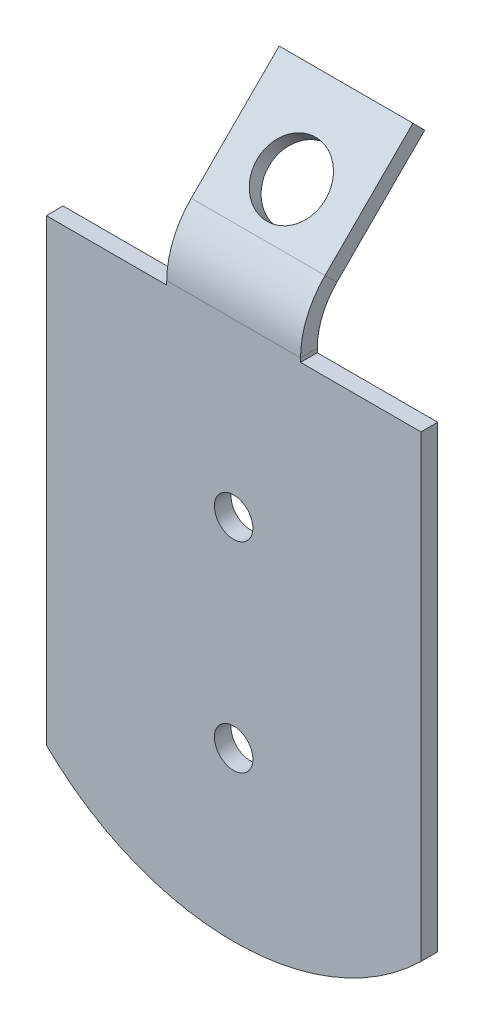
from build123d import *

# Parameters (mm, degrees)
BOSS_EXTRUDE1_DEPTH         = 1.5875
F_6_CLEARANCE_HOLE2_D       = 3.6576
F_6_CLEARANCE_HOLE2_DEPTH   = 38.354
F_6_CLEARANCE_HOLE2_TIP     = 1.0988539
SKETCHED_START              = -6.35
SKETCHED_BEND10_DEPTH       = 12.7
SKETCHED_BEND10_2_DEPTH     = 12.7
CUT_EXTRUDE1_DEPTH          = 45.703347893
F_1_4_CLEARANCE_HOLE1_D     = 6.5278
F_1_4_CLEARANCE_HOLE1_DEPTH = 38.354
F_1_4_CLEARANCE_HOLE1_TIP   = 1.961148974


# Read off the part's stored shape, not the designer's step: Sketched Bend10
with BuildPart() as part:
    # Sketch1 → Boss-Extrude1 (new body)
    with BuildSketch(Plane.XY):
        Polygon((-17.78, -25.4), (17.78, -25.4), (17.78, 25.4), (6.35, 25.4), (6.35, 43.18), (-6.35, 43.18), (-6.35, 25.4), (-17.78, 25.4), align=None)
    extrude(amount=BOSS_EXTRUDE1_DEPTH)

    # #6 Clearance Hole2
    with Locations(Plane(origin=(0, 0, 0), x_dir=(-1, 0, 0), z_dir=(0, 0, -1))):
        with Locations((0, 9.5), (0, -9.5)):
            Hole(F_6_CLEARANCE_HOLE2_D / 2, depth=F_6_CLEARANCE_HOLE2_DEPTH)
            with Locations((0, 0, -(F_6_CLEARANCE_HOLE2_DEPTH + F_6_CLEARANCE_HOLE2_TIP / 2))):  # 118° drill point
                Cone(0, F_6_CLEARANCE_HOLE2_D / 2, F_6_CLEARANCE_HOLE2_TIP, mode=Mode.SUBTRACT)

    # Sketched Bend10 outline → Sketched Bend10 (cut)
    with BuildSketch(Plane.YZ.offset(SKETCHED_START)):
        with BuildLine():
            ThreePointArc((25.769655935, 1.5875), (28.279713828, 1.180173678), (30.532155935, 0))
            Line((30.532155935, 0), (43.18, 0))
            Line((43.18, 0), (43.18, 1.5875))
            Line((43.18, 1.5875), (25.769655935, 1.5875))
        make_face()
    extrude(amount=SKETCHED_BEND10_DEPTH, mode=Mode.SUBTRACT)

    # Sketched Bend10 2 outline → Sketched Bend10 2 (add)
    with BuildSketch(Plane.YZ.offset(SKETCHED_START)):
        with BuildLine():
            Line((39.725932738, -9.080956652), (31.382316011, -0.737339924))
            ThreePointArc((31.382316011, -0.737339924), (30.970319757, -0.353584232), (30.532155935, 0))
            Line((30.532155935, 0), (25.769655935, 0))
            ThreePointArc((25.769655935, 0), (28.19969573, -0.483364969), (30.259783996, -1.859871939))
            Line((30.259783996, -1.859871939), (38.603400723, -10.203488667))
            Line((38.603400723, -10.203488667), (39.725932738, -9.080956652))
        make_face()
    extrude(amount=SKETCHED_BEND10_2_DEPTH)

    # Sketch18 → Cut-Extrude1 (cut, through all)
    with BuildSketch(Plane(origin=(0, 0, 0), x_dir=(-1, 0, 0), z_dir=(0, 0, -1))):
        with BuildLine():
            Line((-17.78, -25.4), (0, -25.4))
            ThreePointArc((0, -25.4), (-9.602697629, -23.51485059), (-17.78, -18.139228208))
            Line((-17.78, -18.139228208), (-17.78, -25.4))
        make_face()
        with BuildLine():
            Line((17.78, -25.4), (17.78, -18.139228208))
            ThreePointArc((17.78, -18.139228208), (9.602697629, -23.51485059), (0, -25.4))
            Line((0, -25.4), (17.78, -25.4))
        make_face()
    extrude(amount=-CUT_EXTRUDE1_DEPTH, mode=Mode.SUBTRACT)

    # 1/4 Clearance Hole1
    with Locations(Plane(origin=(0, 15.322488043, 15.322488043), x_dir=(1, 0, 0), z_dir=(0, 0.7071067811865487, 0.7071067811865465))):
        with Locations((0, 27.173236583)):
            Hole(F_1_4_CLEARANCE_HOLE1_D / 2, depth=F_1_4_CLEARANCE_HOLE1_DEPTH)
            with Locations((0, 0, -(F_1_4_CLEARANCE_HOLE1_DEPTH + F_1_4_CLEARANCE_HOLE1_TIP / 2))):  # 118° drill point
                Cone(0, F_1_4_CLEARANCE_HOLE1_D / 2, F_1_4_CLEARANCE_HOLE1_TIP, mode=Mode.SUBTRACT)


solid = part.part
